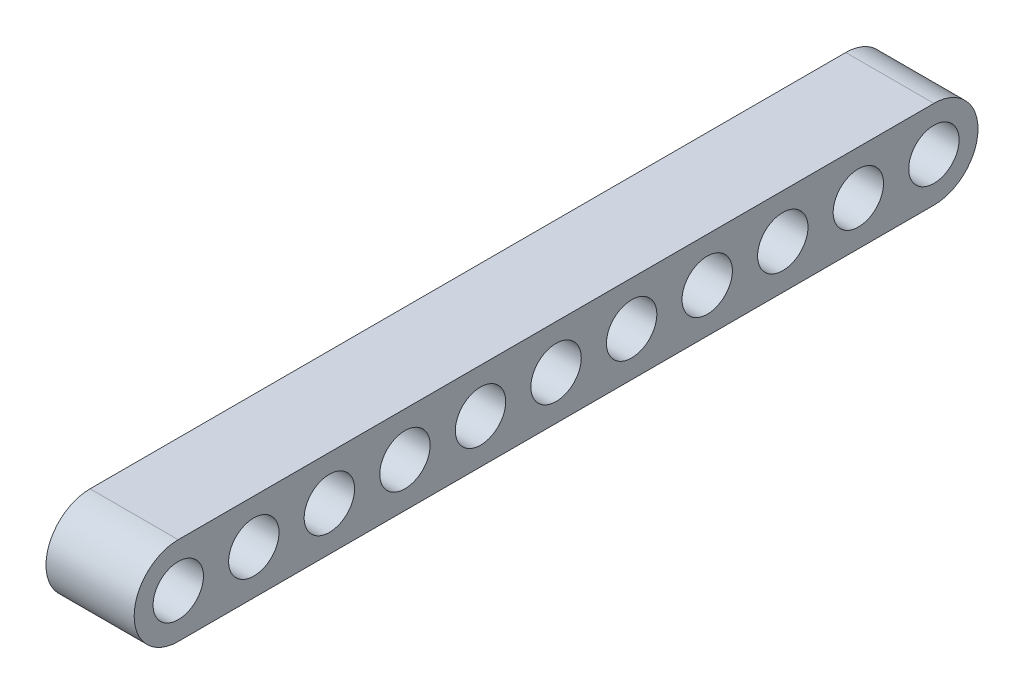
from build123d import *

# Parameters (mm, degrees)
SKETCH1_R           = 20
BOSS_EXTRUDE1_DEPTH = 70


with BuildPart() as part:
    # Sketch1 → Boss-Extrude1 (new body)
    with BuildSketch(Plane(origin=(0, 0, 0), x_dir=(0, 0, -1), z_dir=(1, 0, 0))):
        with BuildLine():
            Line((0, -35), (-600, -35))
            ThreePointArc((-600, -35), (-635, 0), (-600, 35))
            Line((-600, 35), (0, 35))
            ThreePointArc((0, 35), (35, 0), (0, -35))
        make_face()
        with Locations((-600, 0)):
            Circle(SKETCH1_R, mode=Mode.SUBTRACT)
        with Locations((-540, 0)):
            Circle(SKETCH1_R, mode=Mode.SUBTRACT)
        with Locations((-480, 0)):
            Circle(SKETCH1_R, mode=Mode.SUBTRACT)
        with Locations((-420, 0)):
            Circle(SKETCH1_R, mode=Mode.SUBTRACT)
        with Locations((-360, 0)):
            Circle(SKETCH1_R, mode=Mode.SUBTRACT)
        with Locations((-300, 0)):
            Circle(SKETCH1_R, mode=Mode.SUBTRACT)
        with Locations((-240, 0)):
            Circle(SKETCH1_R, mode=Mode.SUBTRACT)
        with Locations((-180, 0)):
            Circle(SKETCH1_R, mode=Mode.SUBTRACT)
        with Locations((-120, 0)):
            Circle(SKETCH1_R, mode=Mode.SUBTRACT)
        with Locations((-60, 0)):
            Circle(SKETCH1_R, mode=Mode.SUBTRACT)
        Circle(SKETCH1_R, mode=Mode.SUBTRACT)
    extrude(amount=BOSS_EXTRUDE1_DEPTH)


solid = part.part
